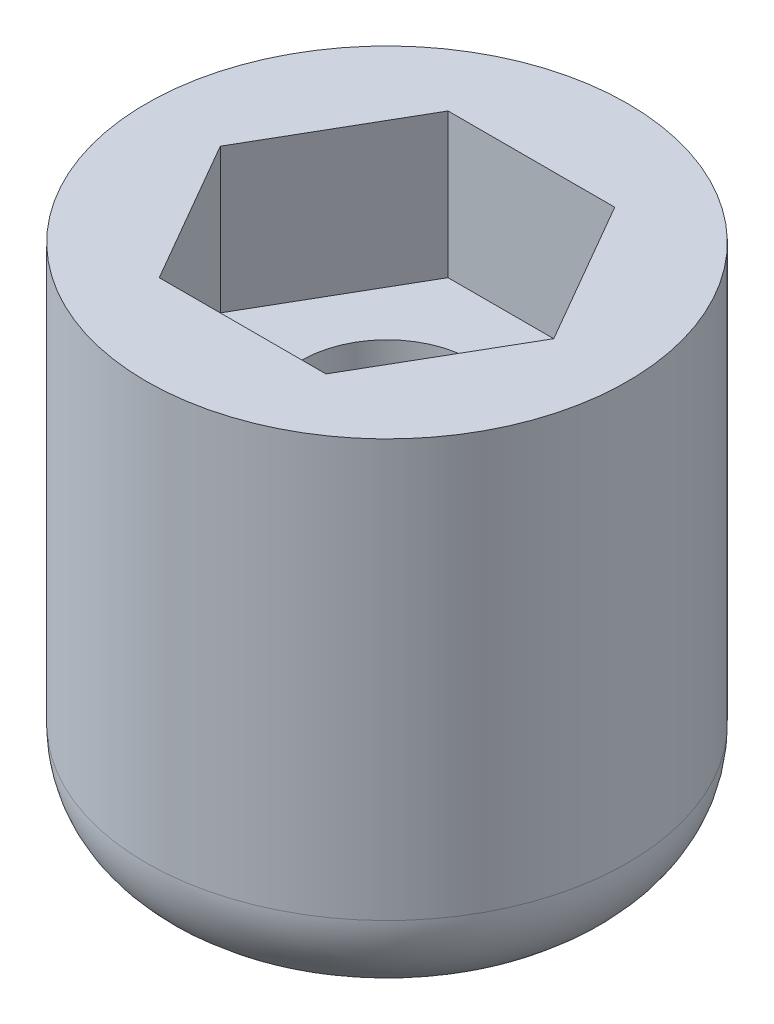
from build123d import *

# Parameters (mm, degrees)
SKETCH1_R           = 7.5
SKETCH1_R_2         = 4.5
BOSS_EXTRUDE1_DEPTH = 10
SKETCH2_R           = 7.5
SKETCH2_R_2         = 2.65
BOSS_EXTRUDE2_DEPTH = 6
CUT_EXTRUDE1_DEPTH  = 4.5
FILLET1_R           = 3
FILLET2_R           = 1


with BuildPart() as part:
    # Sketch1 → Boss-Extrude1 (new body)
    with BuildSketch(Plane(origin=(0, 0, 0), x_dir=(1, 0, 0), z_dir=(0, 1, 0))):
        with Locations(Location((0, 0, 0), (0, 0, 270))):
            Circle(SKETCH1_R)
        with Locations(Location((0, 0, 0), (0, 0, 270))):
            Circle(SKETCH1_R_2, mode=Mode.SUBTRACT)
    extrude(amount=BOSS_EXTRUDE1_DEPTH)

    # Sketch2 → Boss-Extrude2 (add)
    with BuildSketch(Plane(origin=(0, 10, 0), x_dir=(1, 0, 0), z_dir=(0, 1, 0))):
        with Locations(Location((0, 0, 0), (0, 0, 270))):
            Circle(SKETCH2_R)
        with Locations(Location((0, 0, 0), (0, 0, 270))):
            Circle(SKETCH2_R_2, mode=Mode.SUBTRACT)
    extrude(amount=BOSS_EXTRUDE2_DEPTH)

    # Sketch3 → Cut-Extrude1 (cut)
    with BuildSketch(Plane(origin=(0, 16, 0), x_dir=(1, 0, 0), z_dir=(0, 1, 0))):
        Polygon((2.598076211, 4.5), (-2.598076211, 4.5), (-5.196152423, 0), (-2.598076211, -4.5), (2.598076211, -4.5), (5.196152423, 0), align=None)
    extrude(amount=-CUT_EXTRUDE1_DEPTH, mode=Mode.SUBTRACT)

    # Fillet1
    fillet1_edges = [part.edges().sort_by_distance(p)[0] for p in [
        (0, 0, -7.5),
    ]]
    fillet(fillet1_edges, radius=FILLET1_R - 0.0001)  # a hair under: the kernel refuses the full size

    # Fillet2
    fillet2_edges = [part.edges().sort_by_distance(p)[0] for p in [
        (0, 0, -4.5),
    ]]
    fillet(fillet2_edges, radius=FILLET2_R)


solid = part.part
